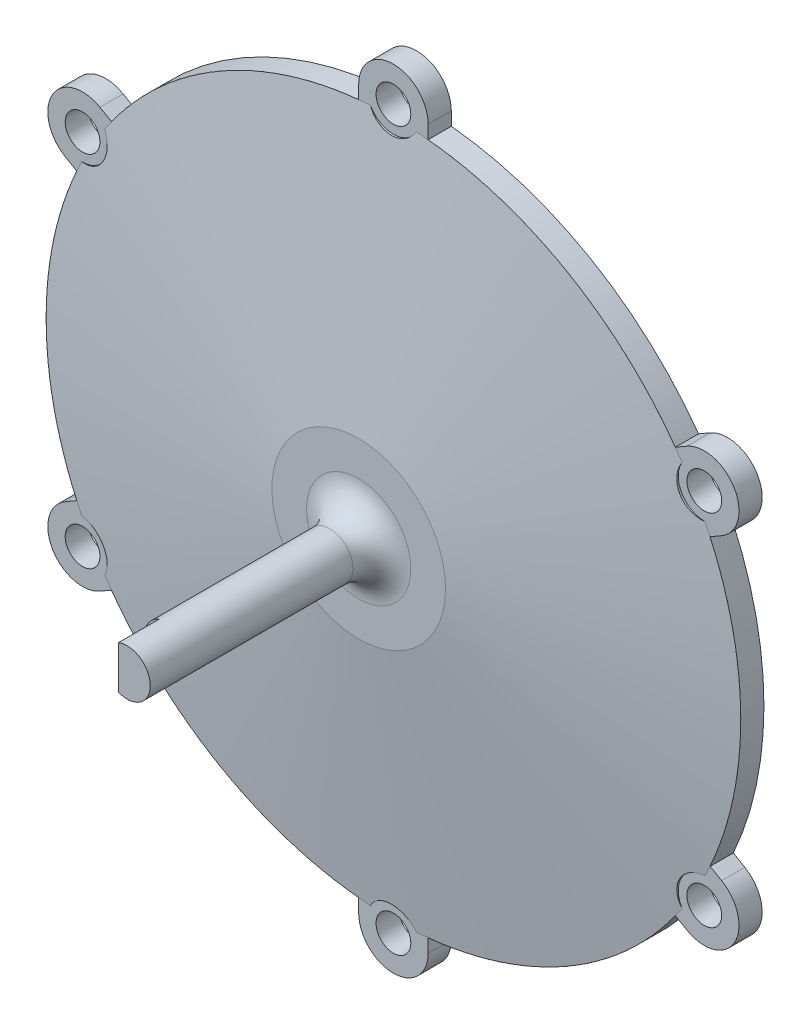
from build123d import *

# Parameters (mm, degrees)
SKETCH1_R           = 57
BOSS_EXTRUDE1_DEPTH = 4
SKETCH4_R           = 14
CUT_EXTRUDE1_DEPTH  = 7
SKETCH9_R           = 10.5
CUT_EXTRUDE4_DEPTH  = 0.5
SKETCH10_R          = 4
BOSS_EXTRUDE2_DEPTH = 40
FILLET1_R           = 5
SKETCH7_R           = 3
CUT_EXTRUDE2_DEPTH  = 102.685790551
SKETCH8_R           = 4.5
CUT_EXTRUDE3_DEPTH  = 102.685790551
CIRPATTERN6_COUNT   = 6
SKETCH11_W          = 2.5
SKETCH11_H          = 7.416198488
CUT_EXTRUDE5_DEPTH  = 7


with BuildPart() as part:
    # Sketch1 → Boss-Extrude1 (new body)
    with BuildSketch(Plane.XY):
        with BuildLine():
            ThreePointArc((6, 62), (0, 68), (-6, 62))
            Line((-6, 62), (-6, 59.699246226))
            ThreePointArc((-6, 59.699246226), (-30, 51.961524227), (-48.701063819, 35.045775536))
            Line((-48.701063819, 35.045775536), (-50.693575035, 36.196152423))
            ThreePointArc((-50.693575035, 36.196152423), (-58.889727457, 34), (-56.693575035, 25.803847577))
            Line((-56.693575035, 25.803847577), (-54.701063819, 24.65347069))
            ThreePointArc((-54.701063819, 24.65347069), (-60, 0), (-54.701063819, -24.65347069))
            Line((-54.701063819, -24.65347069), (-56.693575035, -25.803847577))
            ThreePointArc((-56.693575035, -25.803847577), (-58.889727457, -34), (-50.693575035, -36.196152423))
            Line((-50.693575035, -36.196152423), (-48.701063819, -35.045775536))
            ThreePointArc((-48.701063819, -35.045775536), (-30, -51.961524227), (-6, -59.699246226))
            Line((-6, -59.699246226), (-6, -62))
            ThreePointArc((-6, -62), (0, -68), (6, -62))
            Line((6, -62), (6, -59.699246226))
            ThreePointArc((6, -59.699246226), (30, -51.961524227), (48.701063819, -35.045775536))
            Line((48.701063819, -35.045775536), (50.693575035, -36.196152423))
            ThreePointArc((50.693575035, -36.196152423), (58.889727457, -34), (56.693575035, -25.803847577))
            Line((56.693575035, -25.803847577), (54.701063819, -24.65347069))
            ThreePointArc((54.701063819, -24.65347069), (60, 0), (54.701063819, 24.65347069))
            Line((54.701063819, 24.65347069), (56.693575035, 25.803847577))
            ThreePointArc((56.693575035, 25.803847577), (58.889727457, 34), (50.693575035, 36.196152423))
            Line((50.693575035, 36.196152423), (48.701063819, 35.045775536))
            ThreePointArc((48.701063819, 35.045775536), (30, 51.961524227), (6, 59.699246226))
            Line((6, 59.699246226), (6, 62))
        make_face()
        Circle(SKETCH1_R, mode=Mode.SUBTRACT)
    extrude(amount=BOSS_EXTRUDE1_DEPTH)

    # Sketch7 → Cut-Extrude2 (cut, through all)
    with BuildSketch(Plane.XY.offset(4)):
        with Locations((0, 62)):
            Circle(SKETCH7_R)
    cut_extrude2 = extrude(amount=-CUT_EXTRUDE2_DEPTH, mode=Mode.SUBTRACT)


with BuildPart() as body_2:
    # Sketch3 → Revolve1 (revolve)
    with BuildSketch(Plane(origin=(0, 0, 0), x_dir=(1, 0, 0), z_dir=(0, 1, 0))):
        Polygon((0, -0.5), (0, -10), (15, -10), (60, -4), (57, -4), (57, -0.5), align=None)
    revolve(axis=Axis((0, 0, 10), (0, 0, -1)))

    # Sketch4 → Cut-Extrude1 (cut)
    with BuildSketch(Plane.XY.offset(0.5)):
        Circle(SKETCH4_R)
    extrude(amount=CUT_EXTRUDE1_DEPTH, mode=Mode.SUBTRACT)

    # Sketch9 → Cut-Extrude4 (cut)
    with BuildSketch(Plane(origin=(0, 0, 7.5), x_dir=(-1, 0, 0), z_dir=(0, 0, -1))):
        Circle(SKETCH9_R)
    extrude(amount=-CUT_EXTRUDE4_DEPTH, mode=Mode.SUBTRACT)

    # Sketch10 → Boss-Extrude2 (add)
    with BuildSketch(Plane.XY.offset(10)):
        Circle(SKETCH10_R)
    extrude(amount=BOSS_EXTRUDE2_DEPTH)

    # Fillet1
    fillet1_edges = [body_2.edges().sort_by_distance(p)[0] for p in [
        (-4, 0, 10),
    ]]
    fillet(fillet1_edges, radius=FILLET1_R)

    # Sketch8 → Cut-Extrude3 (cut, through all)
    with BuildSketch(Plane.XY.offset(4)):
        with Locations((0, 62)):
            Circle(SKETCH8_R)
    cut_extrude3 = extrude(amount=CUT_EXTRUDE3_DEPTH, mode=Mode.SUBTRACT)


with BuildPart() as cirpattern6_tool:
    # CirPattern6: Cut-Extrude2, Cut-Extrude3 ×6 about axis
    cirpattern6_axis = Axis((0, 0, 4), (0, 0, 1))
    add([cut_extrude2.rotate(cirpattern6_axis, i * 360 / CIRPATTERN6_COUNT) for i in range(1, CIRPATTERN6_COUNT)])
    add([cut_extrude3.rotate(cirpattern6_axis, i * 360 / CIRPATTERN6_COUNT) for i in range(1, CIRPATTERN6_COUNT)])


with BuildPart() as part_1:
    add(part.part)

    # CirPattern6: cut by cirpattern6_tool
    add(cirpattern6_tool.part, mode=Mode.SUBTRACT)


with BuildPart() as body_2_1:
    add(body_2.part)

    # CirPattern6: cut by cirpattern6_tool
    add(cirpattern6_tool.part, mode=Mode.SUBTRACT)

    # Sketch11 → Cut-Extrude5 (cut)
    with BuildSketch(Plane.XY.offset(50)):
        with Locations((-2.75, 0)):
            Rectangle(SKETCH11_W, SKETCH11_H)
    extrude(amount=-CUT_EXTRUDE5_DEPTH, mode=Mode.SUBTRACT)


solid = Compound([part_1.part, body_2_1.part])
